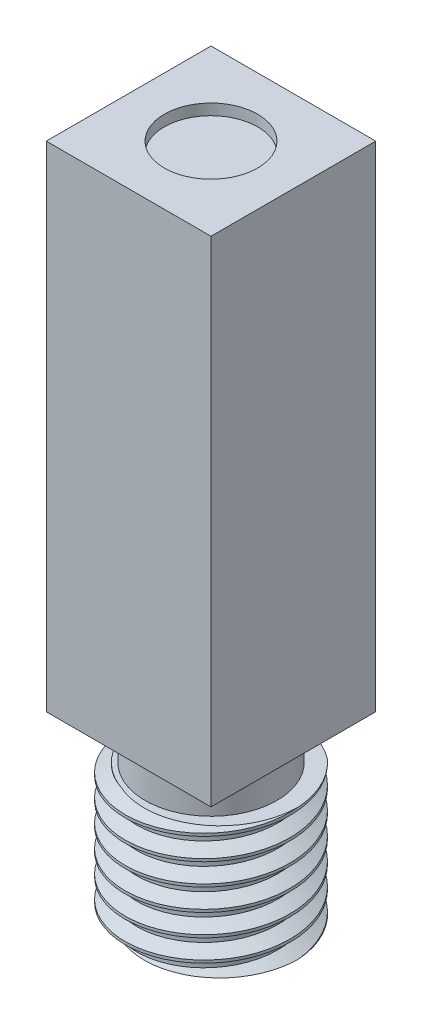
from build123d import *

# Parameters (mm, degrees)
SCHIZZO1_W                   = 15
SCHIZZO1_H                   = 15
ESTRUSIONE_ESTRUSIONE1_DEPTH = 45
SKETCH1_R                    = 6
BOSS_EXTRUDE1_DEPTH          = 4
SKETCH11_R                   = 7.5
BOSS_EXTRUDE2_DEPTH          = 12
THREAD2_PITCH                = 2
SKETCH12_R                   = 4.25
CUT_EXTRUDE1_DEPTH           = 1


with BuildPart() as part:
    # Schizzo1 → Estrusione-Estrusione1 (new body)
    with BuildSketch(Plane(origin=(0, 0, 0), x_dir=(1, 0, 0), z_dir=(0, 1, 0))):
        Rectangle(SCHIZZO1_W, SCHIZZO1_H)
    extrude(amount=ESTRUSIONE_ESTRUSIONE1_DEPTH)

    # Sketch1 → Boss-Extrude1 (add)
    with BuildSketch(Plane.XZ):
        with Locations(Location((0, 0, 0), (0, 0, 270))):
            Circle(SKETCH1_R)
    extrude(amount=BOSS_EXTRUDE1_DEPTH)

    # Sketch11 → Boss-Extrude2 (add)
    with BuildSketch(Plane.XZ.offset(4)):
        with Locations(Location((0, 0, 0), (0, 0, 270))):
            Circle(SKETCH11_R)
    extrude(amount=BOSS_EXTRUDE2_DEPTH)

    # Thread2: the profile of Thread Profile2 profile screwed along a right-hand helix of 7.5 turns, 10 arcs to a turn; built about Z, then put on its axis
    thread2_z = Axis((0, 0, 0), (0, 0, 1))
    thread2_corners = [(7.5003, 2e-09, -0.000173205), (7.5003, 2e-09, 1.7501732), (6.41746825, 2e-09, 1.124999997), (6.41746825, 2e-09, 0.624999997)]
    with BuildLine(mode=Mode.PRIVATE) as thread2_profile:
        Line(thread2_corners[0], thread2_corners[1])
        Line(thread2_corners[1], thread2_corners[2])
        Line(thread2_corners[2], thread2_corners[3])
        Line(thread2_corners[3], thread2_corners[0])
    thread2_cap = Face(thread2_profile.wire())
    thread2_turn_angles = [0, 18, 36, 54, 72, 90, 108, 126, 144, 162, 180, 198, 216, 234, 252, 270, 288, 306, 324, 342, 360]
    thread2_turn_weights = [1, 0.9510565162951535, 1, 0.9510565162951535, 1, 0.9510565162951535, 1, 0.9510565162951535, 1, 0.9510565162951535, 1, 0.9510565162951535, 1, 0.9510565162951535, 1, 0.9510565162951535, 1, 0.9510565162951535, 1, 0.9510565162951535, 1]
    thread2_turn_rails = [Edge.make_bspline([Vector(p[0], p[1], 0).rotate(thread2_z, thread2_turn_angles[k]) / thread2_turn_weights[k] + Vector(0, 0, p[2] + THREAD2_PITCH * thread2_turn_angles[k] / 360) for k in range(21)], [0, 0, 0, 1, 1, 2, 2, 3, 3, 4, 4, 5, 5, 6, 6, 7, 7, 8, 8, 9, 9, 10, 10, 10], 2, thread2_turn_weights) for p in thread2_corners]
    thread2_turn_sides = [Face.make_surface_from_curves(thread2_turn_rails[p[0]], thread2_turn_rails[p[1]]) for p in [(0, 1), (1, 2), (2, 3), (3, 0)]]
    thread2_last_angles = [2520, 2538, 2556, 2574, 2592, 2610, 2628, 2646, 2664, 2682, 2700]
    thread2_last_weights = [1, 0.9510565162951535, 1, 0.9510565162951535, 1, 0.9510565162951535, 1, 0.9510565162951535, 1, 0.9510565162951535, 1]
    thread2_last_rails = [Edge.make_bspline([Vector(p[0], p[1], 0).rotate(thread2_z, thread2_last_angles[k]) / thread2_last_weights[k] + Vector(0, 0, p[2] + THREAD2_PITCH * thread2_last_angles[k] / 360) for k in range(11)], [0, 0, 0, 1, 1, 2, 2, 3, 3, 4, 4, 5, 5, 5], 2, thread2_last_weights) for p in thread2_corners]
    thread2_last_sides = [Face.make_surface_from_curves(thread2_last_rails[p[0]], thread2_last_rails[p[1]]) for p in [(0, 1), (1, 2), (2, 3), (3, 0)]]
    thread2 = Plane(origin=(0, -18, 0), x_dir=(0.998629535, 0, -0.052335956), z_dir=(0, 1, 0)) * Solid(Shell([*[p.moved(Location((0, 0, THREAD2_PITCH * i))) for i in range(7) for p in thread2_turn_sides], *thread2_last_sides, thread2_cap, thread2_cap.rotate(thread2_z, 2700).moved(Location((0, 0, THREAD2_PITCH * 2700 / 360)))]))
    add(thread2, mode=Mode.SUBTRACT)

    # Sketch12 → Cut-Extrude1 (cut)
    with BuildSketch(Plane(origin=(0, 45, 0), x_dir=(1, 0, 0), z_dir=(0, 1, 0))):
        with Locations(Location((0, 0, 0), (0, 0, 270))):
            Circle(SKETCH12_R)
    extrude(amount=-CUT_EXTRUDE1_DEPTH, mode=Mode.SUBTRACT)


solid = part.part
